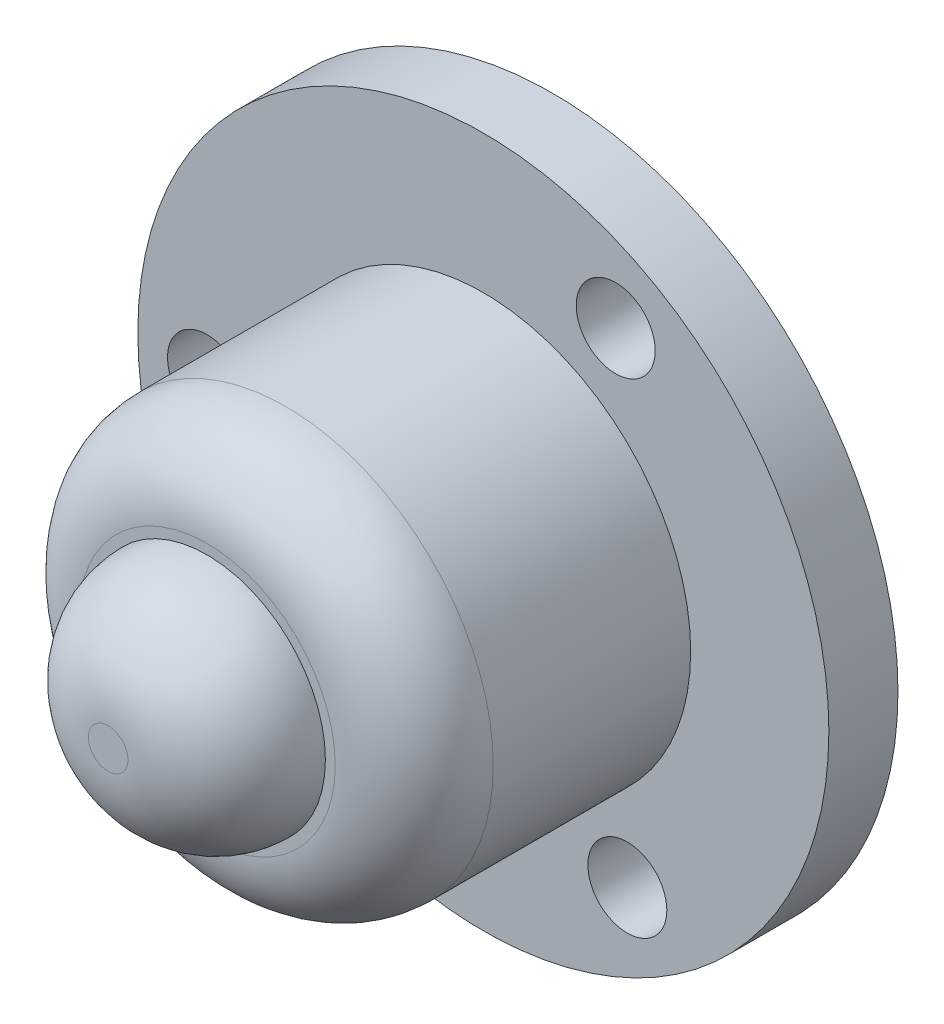
from build123d import *

# Parameters (mm, degrees)
SKETCH1_R           = 17.5
SKETCH1_R_2         = 10
SKETCH1_R_3         = 2
BOSS_EXTRUDE1_DEPTH = 3.5
SKETCH3_R           = 10.5
BOSS_EXTRUDE2_DEPTH = 14
FILLET1_R           = 4
SKETCH4_R           = 6
BOSS_EXTRUDE3_DEPTH = 5
FILLET2_R           = 5


with BuildPart() as part:
    # Sketch1 → Boss-Extrude1 (new body)
    with BuildSketch(Plane.XY):
        Circle(SKETCH1_R)
        Circle(SKETCH1_R_2, mode=Mode.SUBTRACT)
        with Locations((6.70392983, 12.290538021)):
            Circle(SKETCH1_R_3, mode=Mode.SUBTRACT)
        with Locations((7.291953237, -11.951042548)):
            Circle(SKETCH1_R_3, mode=Mode.SUBTRACT)
        with Locations((-13.995883067, -0.339495473)):
            Circle(SKETCH1_R_3, mode=Mode.SUBTRACT)
    extrude(amount=BOSS_EXTRUDE1_DEPTH)

    # Sketch3 → Boss-Extrude2 (add)
    with BuildSketch(Plane.XY.offset(3.5)):
        Circle(SKETCH3_R)
    extrude(amount=BOSS_EXTRUDE2_DEPTH)

    # Fillet1
    fillet1_edges = [part.edges().sort_by_distance(p)[0] for p in [
        (-10.5, 0, 17.5),
    ]]
    fillet(fillet1_edges, radius=FILLET1_R)

    # Sketch4 → Boss-Extrude3 (add)
    with BuildSketch(Plane.XY.offset(17.5)):
        Circle(SKETCH4_R)
    extrude(amount=BOSS_EXTRUDE3_DEPTH)

    # Fillet2
    fillet2_edges = [part.edges().sort_by_distance(p)[0] for p in [
        (-6, 0, 22.5),
    ]]
    fillet(fillet2_edges, radius=FILLET2_R - 0.0001)  # a hair under: the kernel refuses the full size


solid = part.part
